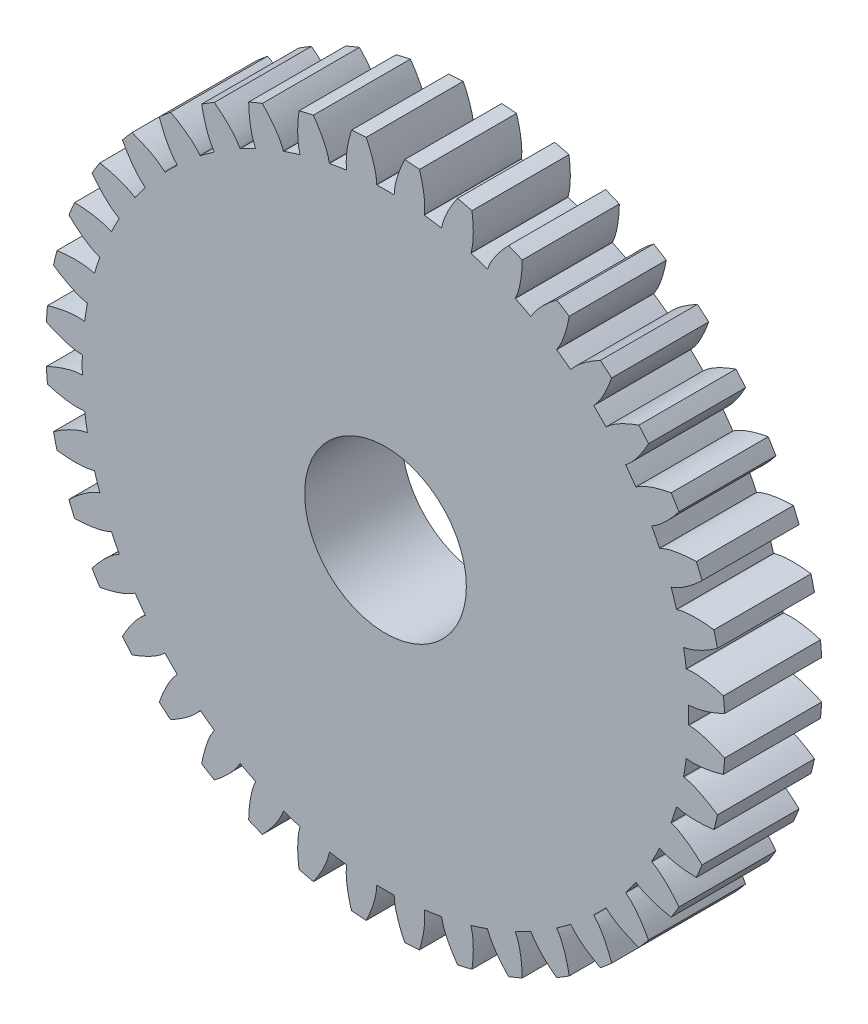
from build123d import *

# Parameters (mm, degrees)
SKETCH_1_R               = 4.2
SKETCH_1_R_2             = 1
EXTRUDE_1_DEPTH          = 1.2
CUT_EXTRUDE_1_DEPTH      = 7.059702963
PATTERN_CIRCULAR_1_COUNT = 40
PATTERN_CIRCULAR_1_ANGLE = 351


with BuildPart() as part:
    # 草图1 → 凸台-拉伸1 (new body)
    with BuildSketch(Plane.XY):
        Circle(SKETCH_1_R)
        Circle(SKETCH_1_R_2, mode=Mode.SUBTRACT)
    extrude(amount=EXTRUDE_1_DEPTH)

    # 草图1<3> → 切除-拉伸1 (cut, through all)
    with BuildSketch(Plane.XY):
        with BuildLine():
            Line((3.757216536, 0.108071482), (3.748449679, 0.107819315))
            ThreePointArc((3.748449679, 0.107819315), (3.7496124, 0.05391523), (3.75, 0))
            ThreePointArc((3.75, 0), (3.7496124, -0.05391523), (3.748449679, -0.107819315))
            Line((3.748449679, -0.107819315), (3.757216536, -0.108071482))
            add(Edge.make_bspline(
                [(3.757216536, -0.108071482), (3.785856782, -0.108895282), (3.865611049, -0.117146717), (3.976985378, -0.146691604), (4.084233721, -0.187355118), (4.162384772, -0.223051153), (4.193246452, -0.238084419)],
                knots=[0, 0, 0, 0, 0, 0.005604068, 0.015718248, 0.022451281, 0.022451281, 0.022451281, 0.022451281, 0.022451281], degree=4))
            ThreePointArc((4.193246452, -0.238084419), (4.198311274, -0.119090093), (4.2, 0))
            ThreePointArc((4.2, 0), (4.198311274, 0.119090093), (4.193246452, 0.238084419))
            add(Edge.make_bspline(
                [(3.757216536, 0.108071482), (3.785856782, 0.108895282), (3.865611049, 0.117146717), (3.976985378, 0.146691604), (4.084233721, 0.187355118), (4.162384772, 0.223051153), (4.193246452, 0.238084419)],
                knots=[0, 0, 0, 0, 0, 0.005604068, 0.015718248, 0.022451281, 0.022451281, 0.022451281, 0.022451281, 0.022451281], degree=4))
        make_face()
    cut_extrude_1 = extrude(amount=CUT_EXTRUDE_1_DEPTH, mode=Mode.SUBTRACT)

    # 阵列(圆周)1: 切除-拉伸1 ×40 about axis
    pattern_circular_1_axis = Axis((0, 0, 1.2), (0, 0, 1))
    for i in range(1, PATTERN_CIRCULAR_1_COUNT):
        add(cut_extrude_1.rotate(pattern_circular_1_axis, i * PATTERN_CIRCULAR_1_ANGLE / (PATTERN_CIRCULAR_1_COUNT - 1)), mode=Mode.SUBTRACT)


solid = part.part
